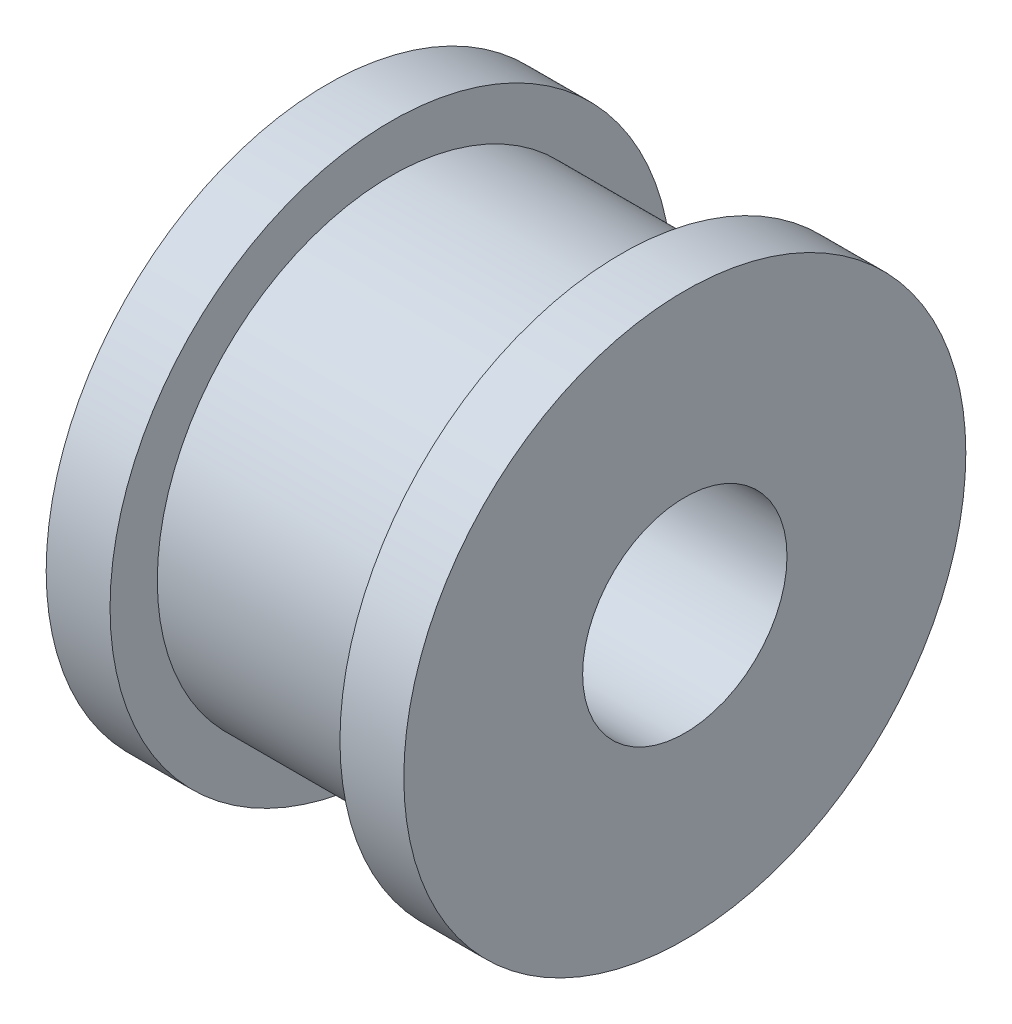
from build123d import *

# Parameters (mm, degrees)
SKETCH1_R           = 11
BOSS_EXTRUDE1_DEPTH = 2.5
SKETCH2_R           = 9.15
BOSS_EXTRUDE2_DEPTH = 9
SKETCH3_R           = 11
BOSS_EXTRUDE3_DEPTH = 2.5
SKETCH4_R           = 4
CUT_EXTRUDE1_DEPTH  = 21.928449536


with BuildPart() as part:
    # Sketch1 → Boss-Extrude1 (new body)
    with BuildSketch(Plane(origin=(0, 0, 0), x_dir=(0, 0, -1), z_dir=(1, 0, 0))):
        Circle(SKETCH1_R)
    extrude(amount=BOSS_EXTRUDE1_DEPTH)

    # Sketch2 → Boss-Extrude2 (add)
    with BuildSketch(Plane(origin=(2.5, 0, 0), x_dir=(0, 0, -1), z_dir=(1, 0, 0))):
        Circle(SKETCH2_R)
    extrude(amount=BOSS_EXTRUDE2_DEPTH)

    # Sketch3 → Boss-Extrude3 (add)
    with BuildSketch(Plane(origin=(11.5, 0, 0), x_dir=(0, 0, -1), z_dir=(1, 0, 0))):
        Circle(SKETCH3_R)
    extrude(amount=BOSS_EXTRUDE3_DEPTH)

    # Sketch4 → Cut-Extrude1 (cut, through all)
    with BuildSketch(Plane(origin=(14, 0, 0), x_dir=(0, 0, -1), z_dir=(1, 0, 0))):
        Circle(SKETCH4_R)
    extrude(amount=-CUT_EXTRUDE1_DEPTH, mode=Mode.SUBTRACT)


solid = part.part
